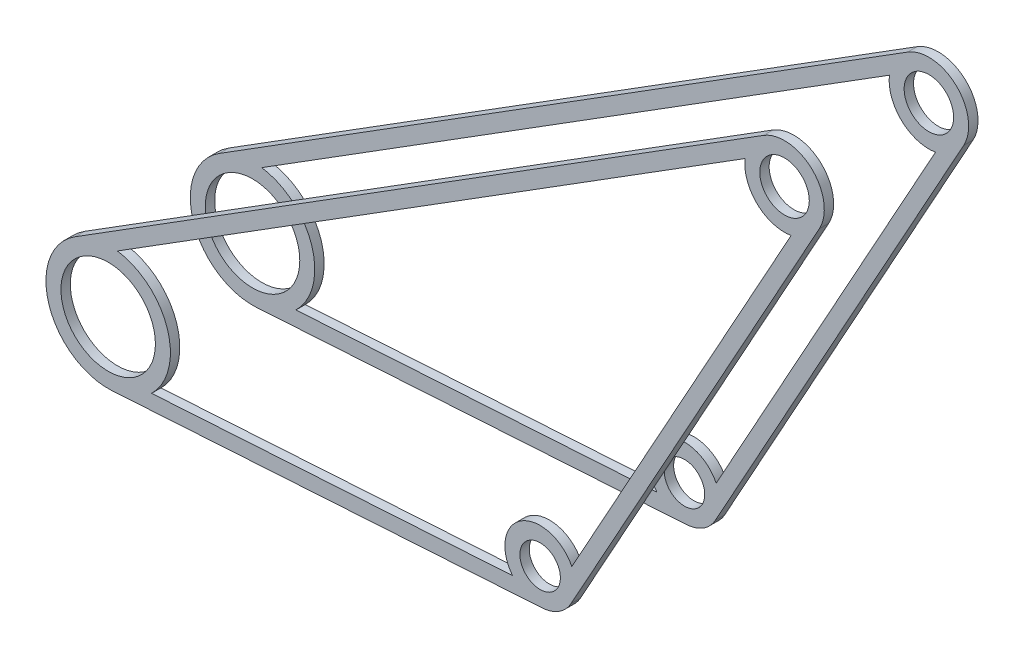
from build123d import *

# Parameters (mm, degrees)
BOSS_EXTRUDE1_START = 11.43
SKETCH1_R           = 8.001
SKETCH1_R_2         = 4.191
SKETCH1_R_3         = 3.429
BOSS_EXTRUDE1_DEPTH = 1.5875
BOSS_EXTRUDE2_START = -11.43
SKETCH1_4_R         = 8.001
SKETCH1_4_R_2       = 4.191
SKETCH1_4_R_3       = 3.429
BOSS_EXTRUDE2_DEPTH = 1.5875


with BuildPart() as part:
    # Sketch1 → Boss-Extrude1 (new body)
    with BuildSketch(Plane.XY.offset(BOSS_EXTRUDE1_START)):
        with BuildLine():
            ThreePointArc((-5.602921506, 8.928603004), (-10.033788157, -3.230445203), (0.6588125, -10.520391965))
            Line((0.6588125, -10.520391965), (73.5250625, -5.95733039))
            ThreePointArc((73.5250625, -5.95733039), (76.342746527, -5.044610748), (78.374819484, -2.889830036))
            Line((78.374819484, -2.889830036), (120.429451286, 73.115937667))
            ThreePointArc((120.429451286, 73.115937667), (119.166673021, 81.263366006), (110.962119735, 82.076079274))
            Line((110.962119735, 82.076079274), (-5.602921506, 8.928603004))
        make_face()
        Circle(SKETCH1_R, mode=Mode.SUBTRACT)
        with BuildLine():
            Line((1.560133531, 10.424905964), (107.850836903, 77.124978473))
            ThreePointArc((107.850836903, 77.124978473), (109.913104757, 71.485998344), (115.656983801, 69.737027472))
            Line((115.656983801, 69.737027472), (78.517746964, 2.61490354))
            ThreePointArc((78.517746964, 2.61490354), (69.961253473, 5.044610748), (68.490076839, -3.727657903))
            Line((68.490076839, -3.727657903), (7.349347762, -7.556438876))
            ThreePointArc((7.349347762, -7.556438876), (10.033788157, 3.230445203), (1.560133531, 10.424905964))
        make_face(mode=Mode.SUBTRACT)
        with Locations((114.539888889, 76.374682175)):
            Circle(SKETCH1_R_2, mode=Mode.SUBTRACT)
        with Locations((73.152, 0)):
            Circle(SKETCH1_R_3, mode=Mode.SUBTRACT)
    extrude(amount=BOSS_EXTRUDE1_DEPTH)


with BuildPart() as body_2:
    # Sketch1<4> → Boss-Extrude2 (new body)
    with BuildSketch(Plane.XY.offset(BOSS_EXTRUDE2_START)):
        with BuildLine():
            ThreePointArc((-5.602921506, 8.928603004), (-10.033788157, -3.230445203), (0.6588125, -10.520391965))
            Line((0.6588125, -10.520391965), (73.5250625, -5.95733039))
            ThreePointArc((73.5250625, -5.95733039), (76.342746527, -5.044610748), (78.374819484, -2.889830036))
            Line((78.374819484, -2.889830036), (120.429451286, 73.115937667))
            ThreePointArc((120.429451286, 73.115937667), (119.166673021, 81.263366006), (110.962119735, 82.076079274))
            Line((110.962119735, 82.076079274), (-5.602921506, 8.928603004))
        make_face()
        Circle(SKETCH1_4_R, mode=Mode.SUBTRACT)
        with BuildLine():
            Line((1.560133531, 10.424905964), (107.850836903, 77.124978473))
            ThreePointArc((107.850836903, 77.124978473), (109.913104757, 71.485998344), (115.656983801, 69.737027472))
            Line((115.656983801, 69.737027472), (78.517746964, 2.61490354))
            ThreePointArc((78.517746964, 2.61490354), (69.961253473, 5.044610748), (68.490076839, -3.727657903))
            Line((68.490076839, -3.727657903), (7.349347762, -7.556438876))
            ThreePointArc((7.349347762, -7.556438876), (10.033788157, 3.230445203), (1.560133531, 10.424905964))
        make_face(mode=Mode.SUBTRACT)
        with Locations((114.539888889, 76.374682175)):
            Circle(SKETCH1_4_R_2, mode=Mode.SUBTRACT)
        with Locations((73.152, 0)):
            Circle(SKETCH1_4_R_3, mode=Mode.SUBTRACT)
    extrude(amount=-BOSS_EXTRUDE2_DEPTH)


solid = Compound([part.part, body_2.part])
